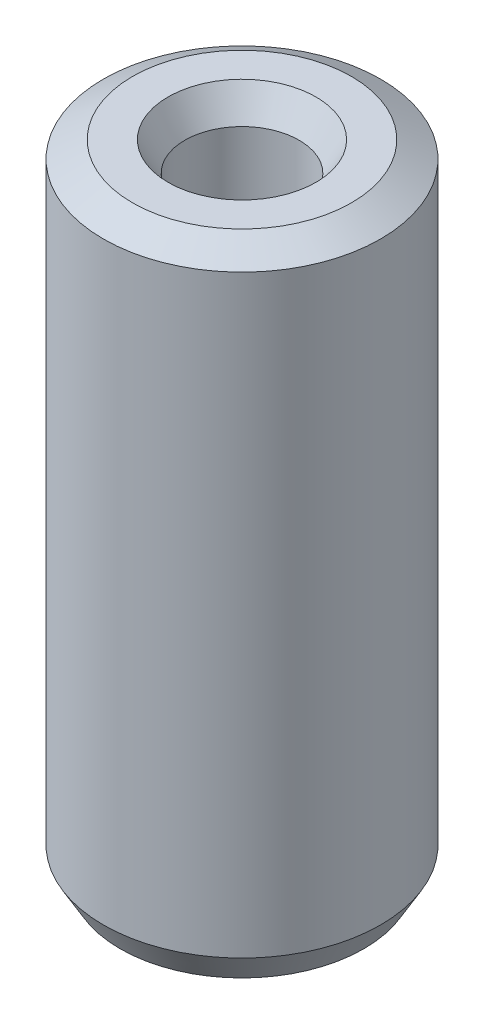
from build123d import *
from OCP.BRepFilletAPI import BRepFilletAPI_MakeChamfer

# Parameters (mm, degrees)
SKETCH1_R           = 22.5
BOSS_EXTRUDE1_DEPTH = 103.908366386
SKETCH2_R           = 9.286560923
CUT_EXTRUDE1_DEPTH  = 109.671286939
CHAMFER1_SIZE       = 2.726954002
CHAMFER1_SIZE2      = 4.723222882


with BuildPart() as part:
    # Sketch1 → Boss-Extrude1 (new body)
    with BuildSketch(Plane(origin=(0, 0, 0), x_dir=(1, 0, 0), z_dir=(0, 1, 0))):
        Circle(SKETCH1_R)
    extrude(amount=BOSS_EXTRUDE1_DEPTH)

    # Sketch2 → Cut-Extrude1 (cut, through all)
    with BuildSketch(Plane(origin=(0, 0, 0), x_dir=(1, 0, 0), z_dir=(0, 1, 0))):
        Circle(SKETCH2_R)
    extrude(amount=CUT_EXTRUDE1_DEPTH, mode=Mode.SUBTRACT)

    # Chamfer1: one chamfer whose edges measure the first distance from different faces: ONE call of the kernel's chamfer builder (chamfer() names one face for all edges)
    chamfer1_edges_1 = [part.edges().sort_by_distance(p)[0] for p in [
        (-9.286560923, 103.908366386, 0),
    ]]
    chamfer1_side_1 = [part.faces().sort_by_distance(p)[0] for p in [
        (-21.863603897, 103.908366386, 0),
    ]]
    chamfer1_edges_2 = [part.edges().sort_by_distance(p)[0] for p in [
        (-9.286560923, 0, 0),
    ]]
    chamfer1_side_2 = [part.faces().sort_by_distance(p)[0] for p in [
        (-9.286560923, 51.954183193, 0),
    ]]
    chamfer1_edges_3 = [part.edges().sort_by_distance(p)[0] for p in [
        (-22.5, 0, 0),
    ]]
    chamfer1_side_3 = [part.faces().sort_by_distance(p)[0] for p in [
        (-21.863603897, 0, 0),
    ]]
    chamfer1_edges_4 = [part.edges().sort_by_distance(p)[0] for p in [
        (-22.5, 103.908366386, 0),
    ]]
    chamfer1_side_4 = [part.faces().sort_by_distance(p)[0] for p in [
        (-22.5, 51.954183193, 0),
    ]]
    chamfer1 = BRepFilletAPI_MakeChamfer(part.part.solid().wrapped)
    for e in chamfer1_edges_1:
        chamfer1.Add(CHAMFER1_SIZE, CHAMFER1_SIZE2, e.wrapped, chamfer1_side_1[0].wrapped)  # the first distance lies on this face
    for e in chamfer1_edges_2:
        chamfer1.Add(CHAMFER1_SIZE, CHAMFER1_SIZE2, e.wrapped, chamfer1_side_2[0].wrapped)  # the first distance lies on this face
    for e in chamfer1_edges_3:
        chamfer1.Add(CHAMFER1_SIZE, CHAMFER1_SIZE2, e.wrapped, chamfer1_side_3[0].wrapped)  # the first distance lies on this face
    for e in chamfer1_edges_4:
        chamfer1.Add(CHAMFER1_SIZE, CHAMFER1_SIZE2, e.wrapped, chamfer1_side_4[0].wrapped)  # the first distance lies on this face
    add(Compound.cast(chamfer1.Shape()), mode=Mode.REPLACE)


solid = part.part
